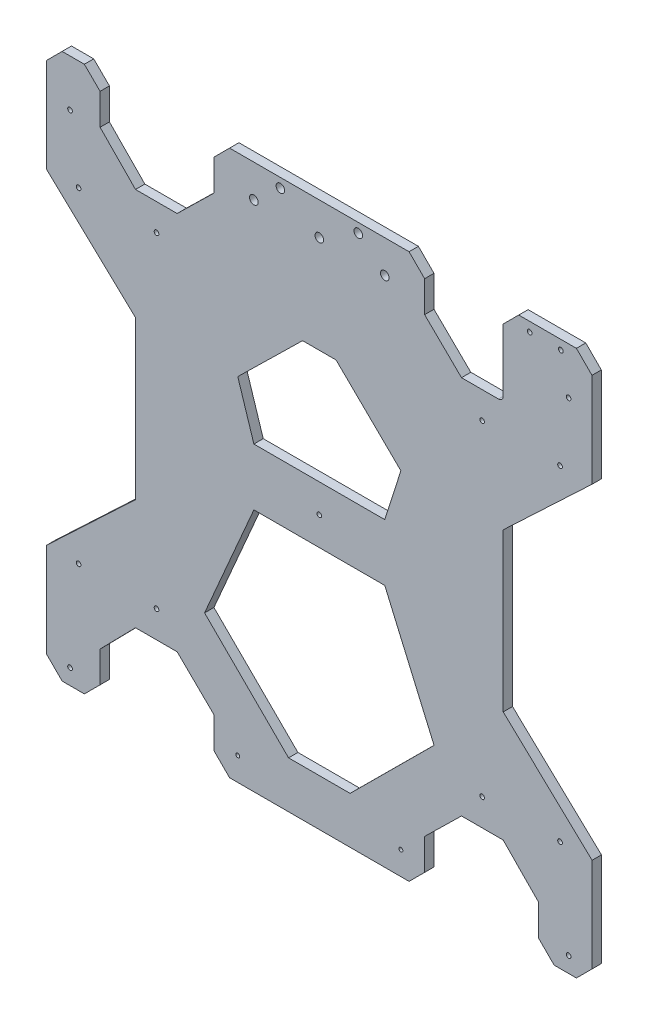
from build123d import *

# Parameters (mm, degrees)
SCHIZZO13_R                  = 1.5
SCHIZZO13_R_2                = 2.75
SCHIZZO13_R_3                = 1.25
ESTRUSIONE_ESTRUSIONE2_DEPTH = 6


with BuildPart() as part:
    # Schizzo13 → Estrusione-Estrusione2 (new body)
    with BuildSketch(Plane.XY):
        with BuildLine():
            Line((9.919241786, 0), (24.201199756, 0))
            Line((24.201199756, 0), (34.201199756, 10))
            Line((34.201199756, 10), (34.28195797, 30))
            Line((34.28195797, 30), (57.017366293, 53.192694567))
            Line((57.017366293, 53.192694567), (83.745372993, 53.192694567))
            Line((83.745372993, 53.192694567), (107.404551383, 30))
            Line((107.404551383, 30), (107.404551383, 10))
            Line((107.404551383, 10), (117.404551383, 0))
            Line((117.404551383, 0), (232.595448617, 0))
            Line((232.595448617, 0), (242.595448617, 10))
            Line((242.595448617, 10), (242.595448617, 30))
            Line((242.595448617, 30), (266.254627007, 53.192694567))
            Line((266.254627007, 53.192694567), (292.982633707, 53.192694567))
            Line((292.982633707, 53.192694567), (315.71804203, 30))
            Line((315.71804203, 30), (315.71804203, 10))
            Line((315.71804203, 10), (325.71804203, 0))
            Line((325.71804203, 0), (340, 0))
            Line((340, 0), (350, 10))
            Line((350, 10), (350.080758214, 70.5))
            Line((350.080758214, 70.5), (293, 124.388863529))
            Line((293, 124.388863529), (293, 225.611136471))
            Line((293, 225.611136471), (350.080758214, 279.5))
            Line((350.080758214, 279.5), (350, 340))
            Line((350, 340), (340, 350))
            Line((340, 350), (302.982633707, 350))
            Line((302.982633707, 350), (292.982633707, 340))
            Line((292.982633707, 340), (292.982633707, 299.807305433))
            ThreePointArc((292.982633707, 299.807305433), (292.103954051, 297.685985089), (289.982633707, 296.807305433))
            Line((289.982633707, 296.807305433), (266.254627007, 296.807305433))
            Line((266.254627007, 296.807305433), (242.595448617, 320))
            Line((242.595448617, 320), (242.595448617, 340))
            Line((242.595448617, 340), (232.595448617, 350))
            Line((232.595448617, 350), (117.404551383, 350))
            Line((117.404551383, 350), (107.404551383, 340))
            Line((107.404551383, 340), (107.404551383, 320))
            Line((107.404551383, 320), (83.745372993, 296.807305433))
            Line((83.745372993, 296.807305433), (57.017366293, 296.807305433))
            Line((57.017366293, 296.807305433), (34.28195797, 320))
            Line((34.28195797, 320), (34.28195797, 340))
            Line((34.28195797, 340), (24.201199756, 350))
            Line((24.201199756, 350), (9.919241786, 350))
            Line((9.919241786, 350), (-0.080758214, 340))
            Line((-0.080758214, 340), (-0.080758214, 279.5))
            Line((-0.080758214, 279.5), (57, 225.611136471))
            Line((57, 225.611136471), (57, 175))
            Line((57, 175), (57, 124.388863529))
            Line((57, 124.388863529), (-0.080758214, 70.5))
            Line((-0.080758214, 70.5), (-0.080758214, 10))
            Line((-0.080758214, 10), (9.919241786, 0))
        make_face()
        with Locations((15, 320)):
            Circle(SCHIZZO13_R, mode=Mode.SUBTRACT)
        with Locations((20.5, 279.5)):
            Circle(SCHIZZO13_R, mode=Mode.SUBTRACT)
        with Locations((70.5, 279.5)):
            Circle(SCHIZZO13_R, mode=Mode.SUBTRACT)
        with Locations((175, 175)):
            Circle(SCHIZZO13_R, mode=Mode.SUBTRACT)
        with Locations((20.5, 70.5)):
            Circle(SCHIZZO13_R, mode=Mode.SUBTRACT)
        with Locations((200, 344)):
            Circle(SCHIZZO13_R_2, mode=Mode.SUBTRACT)
        with Locations((150, 344)):
            Circle(SCHIZZO13_R_2, mode=Mode.SUBTRACT)
        with Locations((175, 329)):
            Circle(SCHIZZO13_R_2, mode=Mode.SUBTRACT)
        with Locations((217, 329)):
            Circle(SCHIZZO13_R_2, mode=Mode.SUBTRACT)
        with Locations((133, 329)):
            Circle(SCHIZZO13_R_2, mode=Mode.SUBTRACT)
        with Locations((70.5, 70.5)):
            Circle(SCHIZZO13_R, mode=Mode.SUBTRACT)
        with Locations((279.5, 70.5)):
            Circle(SCHIZZO13_R, mode=Mode.SUBTRACT)
        with Locations((329.5, 70.5)):
            Circle(SCHIZZO13_R, mode=Mode.SUBTRACT)
        with Locations((335, 10)):
            Circle(SCHIZZO13_R, mode=Mode.SUBTRACT)
        with Locations((15, 10)):
            Circle(SCHIZZO13_R, mode=Mode.SUBTRACT)
        with Locations((279.5, 279.5)):
            Circle(SCHIZZO13_R, mode=Mode.SUBTRACT)
        with Locations((329.5, 279.5)):
            Circle(SCHIZZO13_R, mode=Mode.SUBTRACT)
        with Locations((335, 320)):
            Circle(SCHIZZO13_R, mode=Mode.SUBTRACT)
        with Locations((310, 344)):
            Circle(SCHIZZO13_R, mode=Mode.SUBTRACT)
        with Locations((330, 344)):
            Circle(SCHIZZO13_R, mode=Mode.SUBTRACT)
        with Locations((122.656966622, 15)):
            Circle(SCHIZZO13_R_3, mode=Mode.SUBTRACT)
        with Locations((227.343033378, 15)):
            Circle(SCHIZZO13_R_3, mode=Mode.SUBTRACT)
        Polygon((217, 193.286910978), (227.343033378, 225.611136471), (185.750894453, 266.383210572), (164.249105547, 266.383210572), (122.656966622, 225.611136471), (133, 193.286910978), align=None, mode=Mode.SUBTRACT)
        Polygon((133, 156.713089022), (101.348199345, 83.616789428), (155.254193112, 30), (194.745806888, 30), (248.651800655, 83.616789428), (217, 156.713089022), align=None, mode=Mode.SUBTRACT)
    extrude(amount=-ESTRUSIONE_ESTRUSIONE2_DEPTH)


solid = part.part
